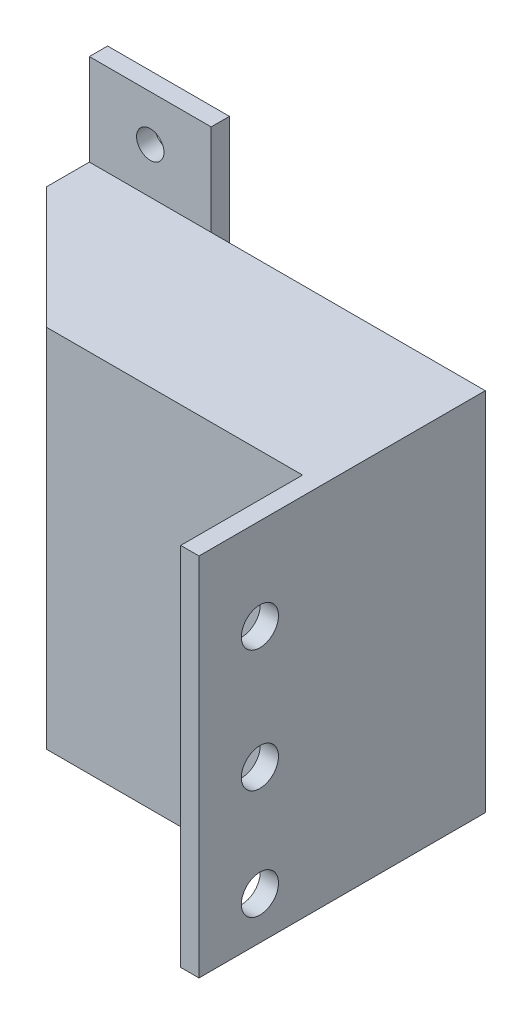
from build123d import *

# Parameters (mm, degrees)
SKETCH_1_W          = 5.1
SKETCH_1_H          = 50
EXTRUDE_1_DEPTH     = 2
SKETCH_2_W          = 20
SKETCH_2_H          = 60
EXTRUDE_2_DEPTH     = 30
SKETCH_3_W          = 3
SKETCH_3_H          = 60
EXTRUDE_3_DEPTH     = 45
FILLET_1_R          = 10
CHAMFER_1_SIZE      = 20
SKETCH_5_W          = 20
SKETCH_5_H          = 3
EXTRUDE_4_DEPTH     = 15
HOLE_WIZARD_M4_1_D  = 4.5
WRAP_START          = -11
WRAP_1_OUTLINE_W    = 0.358974359
WRAP_1_OUTLINE_H    = 1.346153846
WRAP_1_DEPTH        = 1
SKETCH_10_W         = 3
SKETCH_10_H         = 60
EXTRUDE_5_DEPTH     = 45
SKETCH_11_W         = 3
SKETCH_11_H         = 60
EXTRUDE_6_DEPTH     = 21
SKETCH_13_W         = 3
SKETCH_13_H         = 60
EXTRUDE_7_DEPTH     = 20
SKETCH_4_R          = 3.05
CUT_EXTRUDE_1_DEPTH = 20
SKETCH_14_W         = 21
SKETCH_14_H         = 60
EXTRUDE_8_DEPTH     = 42


# Read off the part's stored shape, not the designer's step: 곡면 포장1
with BuildPart() as part:
    # 스케치1 → 보스-돌출1 (new body)
    with BuildSketch(Plane.XY):
        Rectangle(SKETCH_1_W, SKETCH_1_H)
    extrude(amount=EXTRUDE_1_DEPTH)

    # 스케치2 → 보스-돌출2 (add)
    with BuildSketch(Plane.XY.offset(2)):
        Rectangle(SKETCH_2_W, SKETCH_2_H)
    extrude(amount=EXTRUDE_2_DEPTH)

    # 스케치3 → 보스-돌출3 (add)
    with BuildSketch(Plane.ZY.offset(-10)):
        with Locations((30.5, 0)):
            Rectangle(SKETCH_3_W, SKETCH_3_H)
    extrude(amount=-EXTRUDE_3_DEPTH)

    # 필렛1
    fillet_1_edges = [part.edges().sort_by_distance(p)[0] for p in [
        (10, 0, 29),
    ]]
    fillet(fillet_1_edges, radius=FILLET_1_R)

    # 모따기1
    chamfer_1_edges = [part.edges().sort_by_distance(p)[0] for p in [
        (-10, 0, 32),
    ]]
    chamfer(chamfer_1_edges, length=CHAMFER_1_SIZE)

    # 스케치5 → 보스-돌출4 (add)
    with BuildSketch(Plane.XZ.offset(30)):
        with Locations((0, 3.5)):
            Rectangle(SKETCH_5_W, SKETCH_5_H)
    extrude_4 = extrude(amount=EXTRUDE_4_DEPTH)

    # M4 여유 구멍1 (through all)
    with Locations(Plane.XY.offset(5)):
        with Locations((0, -37.5)):
            hole_wizard_m4_1 = Hole(HOLE_WIZARD_M4_1_D / 2)

    # 대칭 복사1: 보스-돌출4, M4 여유 구멍1 across plane
    add(extrude_4.mirror(Plane.ZX))
    add(hole_wizard_m4_1.mirror(Plane.ZX), mode=Mode.SUBTRACT)

    # 곡면 포장1 outline → 곡면 포장1 (cut)
    # profile 1 of 15: a face of its own
    with BuildSketch(Plane(origin=(-18.071067812, 0, 18.071067812), x_dir=(0.7071067811865461, 0, 0.7071067811865489), z_dir=(-0.7071067811865489, 0, 0.7071067811865461)).offset(WRAP_START)):
        with BuildLine():
            add(Edge.make_bspline(
                [(13.788664107, -7.655548878), (13.788508521, -7.702290007), (13.788209778, -7.792038151), (13.786544015, -7.920611421), (13.78176966, -8.037438518), (13.777661076, -8.142458358), (13.770169135, -8.235669013), (13.763008488, -8.317356304), (13.753634827, -8.387144001), (13.744929404, -8.429389852), (13.740987824, -8.448517628)],
                knots=[0, 0, 0, 0, 0.176257755, 0.338434414, 0.484822051, 0.617157578, 0.734698361, 0.837385184, 0.926372421, 1, 1, 1, 1], degree=3))
            Line((13.788664107, -7.655548878), (13.788664107, -6.955128205))
            Line((13.788664107, -6.955128205), (10.288664107, -6.955128205))
            Line((10.288664107, -6.955128205), (10.288664107, -7.269230769))
            Line((10.288664107, -7.269230769), (11.904048722, -7.269230769))
            Line((11.904048722, -7.269230769), (11.904048722, -7.524439103))
            Line((11.904048722, -7.524439103), (10.288664107, -8.810296474))
            Line((10.288664107, -8.810296474), (10.288664107, -9.198717949))
            Line((10.288664107, -9.198717949), (11.904048722, -7.912860577))
            add(Edge.make_bspline(
                [(12.85266651, -9.153846154), (12.806031352, -9.152377194), (12.71503408, -9.149510872), (12.582973948, -9.122785236), (12.459781892, -9.079010664), (12.345629353, -9.0186802), (12.242681333, -8.941887277), (12.152564561, -8.849599644), (12.076456841, -8.742288611), (12.024240237, -8.641920056), (11.990641836, -8.553217672), (11.966883204, -8.479978002), (11.948836227, -8.400025238), (11.932434047, -8.314506424), (11.919917866, -8.222761003), (11.911028998, -8.12497373), (11.905313389, -8.020900031), (11.904478314, -7.949560269), (11.904048722, -7.912860577)],
                knots=[0, 0, 0, 0, 0.078775142, 0.153710705, 0.226698871, 0.29917182, 0.371165996, 0.44297777, 0.516334013, 0.592857108, 0.63351018, 0.676623617, 0.722915422, 0.771971354, 0.823829257, 0.87938645, 0.937952132, 1, 1, 1, 1], degree=3))
            add(Edge.make_bspline(
                [(13.740987824, -8.448517628), (13.734661777, -8.474124703), (13.722144633, -8.524792585), (13.69567462, -8.597736108), (13.665093411, -8.667274573), (13.628895853, -8.733147024), (13.587713309, -8.795359571), (13.541305165, -8.853819065), (13.489435081, -8.908191276), (13.433427601, -8.958894573), (13.372794043, -9.004855479), (13.308417674, -9.044628631), (13.24070113, -9.07868618), (13.169408597, -9.105875346), (13.095142736, -9.127748197), (13.017255067, -9.143175849), (12.93609378, -9.152426646), (12.880735914, -9.153368555), (12.85266651, -9.153846154)],
                knots=[0, 0, 0, 0, 0.064210805, 0.127051819, 0.188726793, 0.24910868, 0.309897111, 0.370265578, 0.430668931, 0.492744591, 0.554114032, 0.615725916, 0.67682809, 0.73846364, 0.80133559, 0.865197187, 0.931647751, 1, 1, 1, 1], degree=3))
        make_face()
        with BuildLine():
            add(Edge.make_bspline(
                [(12.258115228, -7.91005609), (12.258101992, -7.939976129), (12.258076336, -7.997969685), (12.262070111, -8.081870352), (12.266613433, -8.159990458), (12.273562764, -8.232031229), (12.282518884, -8.298024742), (12.293721711, -8.35793836), (12.306774287, -8.411868744), (12.32697375, -8.474770095), (12.358994389, -8.544987611), (12.405502542, -8.621393654), (12.464378168, -8.686238827), (12.530631533, -8.742147935), (12.60497392, -8.785212188), (12.68410555, -8.816555408), (12.767343253, -8.836225025), (12.824515097, -8.838563465), (12.853367632, -8.83974359)],
                knots=[0, 0, 0, 0, 0.071662971, 0.138903248, 0.201170031, 0.259105703, 0.312232476, 0.360655445, 0.40505687, 0.445069493, 0.518740291, 0.589418982, 0.658414658, 0.727587276, 0.796337206, 0.863184781, 0.930954371, 1, 1, 1, 1], degree=3))
            Line((12.258115228, -7.91005609), (12.263023081, -7.269230769))
            Line((12.263023081, -7.269230769), (13.429689748, -7.269230769))
            Line((13.429689748, -7.269230769), (13.429689748, -7.925480769))
            add(Edge.make_bspline(
                [(12.853367632, -8.83974359), (12.881522011, -8.838559837), (12.937313718, -8.836214072), (13.018767154, -8.816517297), (13.096194016, -8.784709886), (13.168118494, -8.740108534), (13.233950486, -8.686214641), (13.289499403, -8.622207629), (13.336018384, -8.55131097), (13.365528527, -8.485000748), (13.383657077, -8.425772592), (13.396398241, -8.374340485), (13.40672109, -8.316005715), (13.41474691, -8.250908084), (13.42196923, -8.179165363), (13.426651992, -8.100581107), (13.429482253, -8.015246064), (13.429618973, -7.956098882), (13.429689748, -7.925480769)],
                knots=[0, 0, 0, 0, 0.068800096, 0.136336686, 0.203757018, 0.272787156, 0.342622324, 0.411089038, 0.479278287, 0.549403054, 0.587738712, 0.630724933, 0.678947097, 0.73255864, 0.791154526, 0.855313051, 0.925101397, 1, 1, 1, 1], degree=3))
        make_face(mode=Mode.SUBTRACT)
    # profile 2 of 15: a face of its own
    with BuildSketch(Plane(origin=(-18.071067812, 0, 18.071067812), x_dir=(0.7071067811865461, 0, 0.7071067811865489), z_dir=(-0.7071067811865489, 0, 0.7071067811865461)).offset(WRAP_START)):
        with BuildLine():
            add(Edge.make_bspline(
                [(13.788664107, -1.469551282), (13.788222743, -1.531020398), (13.78737003, -1.64977841), (13.781932485, -1.821389146), (13.772410584, -1.979946438), (13.758273272, -2.125360242), (13.741304536, -2.257864179), (13.719724539, -2.377246028), (13.694345003, -2.483699256), (13.672698534, -2.549168569), (13.662462183, -2.580128205)],
                knots=[0, 0, 0, 0, 0.164289634, 0.317406718, 0.458844777, 0.588746286, 0.707830576, 0.815769563, 0.912879682, 1, 1, 1, 1], degree=3))
            Line((13.788664107, -1.469551282), (13.788664107, -0.762820513))
            Line((13.788664107, -0.762820513), (10.288664107, -0.762820513))
            Line((10.288664107, -0.762820513), (10.288664107, -1.847455929))
            add(Edge.make_bspline(
                [(11.994493433, -3.634615385), (11.951232341, -3.633985993), (11.865981841, -3.632745712), (11.740338851, -3.621622463), (11.618432932, -3.605423973), (11.500799481, -3.580460174), (11.386646065, -3.549785684), (11.276514786, -3.511923904), (11.170324918, -3.46705403), (11.068941453, -3.414995964), (10.97253211, -3.35807278), (10.882755925, -3.295659839), (10.797905473, -3.231338607), (10.721807952, -3.160149504), (10.650111093, -3.086998251), (10.586688808, -3.008005778), (10.528778473, -2.925745612), (10.47680279, -2.838633295), (10.431708128, -2.744580876), (10.393076333, -2.642304664), (10.361266928, -2.531256899), (10.334685156, -2.41160779), (10.313611046, -2.28312289), (10.299483718, -2.145684341), (10.289931054, -1.999500932), (10.289094622, -1.899121683), (10.288664107, -1.847455929)],
                knots=[0, 0, 0, 0, 0.046075764, 0.090797106, 0.134280935, 0.177005489, 0.218799375, 0.260134691, 0.300966082, 0.341495783, 0.38146104, 0.4201336, 0.457931555, 0.494759361, 0.531031765, 0.566959908, 0.602530875, 0.638141029, 0.674887957, 0.713497957, 0.754468017, 0.797836943, 0.84400611, 0.893082984, 0.944969221, 1, 1, 1, 1], degree=3))
            add(Edge.make_bspline(
                [(13.662462183, -2.580128205), (13.647031461, -2.620622919), (13.616519932, -2.70069406), (13.558963882, -2.814701556), (13.493749844, -2.92202553), (13.420797433, -3.023249794), (13.338020201, -3.116031516), (13.249011593, -3.204111294), (13.150134467, -3.283535156), (13.044746001, -3.357490427), (12.931777075, -3.422202498), (12.813520445, -3.479271028), (12.69019738, -3.527997589), (12.560910273, -3.566017725), (12.42690027, -3.597428834), (12.287152918, -3.61850494), (12.142482909, -3.632504944), (12.044307183, -3.633905003), (11.994493433, -3.634615385)],
                knots=[0, 0, 0, 0, 0.061542118, 0.121688665, 0.181146473, 0.239864289, 0.298688121, 0.357630874, 0.417585519, 0.478660874, 0.54040425, 0.602339327, 0.665116206, 0.728571869, 0.79366009, 0.860540721, 0.929239235, 1, 1, 1, 1], degree=3))
        make_face()
        with BuildLine():
            add(Edge.make_bspline(
                [(10.647638466, -1.478665865), (10.647886562, -1.536394236), (10.648363742, -1.647427035), (10.652550945, -1.807085032), (10.659392883, -1.952964428), (10.668967961, -2.085085938), (10.681636576, -2.203374962), (10.695761478, -2.308078712), (10.713358929, -2.39885397), (10.729309889, -2.453783407), (10.736680933, -2.479166667)],
                knots=[0, 0, 0, 0, 0.171900665, 0.330627932, 0.475548836, 0.60674619, 0.725023803, 0.829742387, 0.92132282, 1, 1, 1, 1], degree=3))
            Line((10.647638466, -1.478665865), (10.647638466, -1.076923077))
            Line((10.647638466, -1.076923077), (13.429689748, -1.076923077))
            Line((13.429689748, -1.076923077), (13.429689748, -1.323016827))
            add(Edge.make_bspline(
                [(13.331532696, -2.39853766), (13.339649124, -2.369186514), (13.356906877, -2.306777924), (13.375732249, -2.20493846), (13.392336748, -2.09032331), (13.406394788, -1.962423609), (13.416482109, -1.82138515), (13.424053424, -1.667099462), (13.429160056, -1.499499857), (13.429508763, -1.383317324), (13.429689748, -1.323016827)],
                knots=[0, 0, 0, 0, 0.084318617, 0.179284514, 0.286582528, 0.405111483, 0.535592873, 0.67819021, 0.83297584, 1, 1, 1, 1], degree=3))
            add(Edge.make_bspline(
                [(11.995194555, -3.320512821), (12.03612779, -3.319998986), (12.116541493, -3.318989554), (12.234535663, -3.306322999), (12.348003724, -3.287773342), (12.45702737, -3.261091108), (12.561464756, -3.226619962), (12.661905911, -3.185372441), (12.757058251, -3.135291477), (12.847727682, -3.078594531), (12.932541072, -3.014941825), (13.010504786, -2.94461572), (13.081764053, -2.868357763), (13.146432328, -2.786519402), (13.203359577, -2.6979564), (13.254001168, -2.604167416), (13.297029276, -2.503831307), (13.31990646, -2.434017297), (13.331532696, -2.39853766)],
                knots=[0, 0, 0, 0, 0.070142057, 0.137794692, 0.20319983, 0.267139326, 0.329981104, 0.39158851, 0.453055056, 0.514082611, 0.574740811, 0.634598519, 0.69384165, 0.753473671, 0.813150092, 0.874096054, 0.936015332, 1, 1, 1, 1], degree=3))
            add(Edge.make_bspline(
                [(10.736680933, -2.479166667), (10.747931653, -2.511115704), (10.770164369, -2.574250677), (10.810734156, -2.665121994), (10.85873149, -2.749915039), (10.912398678, -2.830044457), (10.972566871, -2.904991377), (11.039418178, -2.974423322), (11.112213278, -3.038833767), (11.191224867, -3.097518126), (11.275942115, -3.149955691), (11.365286501, -3.195660839), (11.459042394, -3.234440983), (11.557547712, -3.265974844), (11.660709606, -3.290411773), (11.768256677, -3.30779836), (11.880222476, -3.318607055), (11.956374251, -3.319869339), (11.995194555, -3.320512821)],
                knots=[0, 0, 0, 0, 0.062403939, 0.123317361, 0.183093551, 0.241742082, 0.300863085, 0.359954277, 0.419145826, 0.479784587, 0.541094082, 0.602536544, 0.664519988, 0.727851781, 0.792929859, 0.859696073, 0.928476505, 1, 1, 1, 1], degree=3))
        make_face(mode=Mode.SUBTRACT)
    # profile 3 of 15: a face of its own
    with BuildSketch(Plane(origin=(-18.071067812, 0, 18.071067812), x_dir=(0.7071067811865461, 0, 0.7071067811865489), z_dir=(-0.7071067811865489, 0, 0.7071067811865461)).offset(WRAP_START)):
        with BuildLine():
            add(Edge.make_bspline(
                [(12.04006635, 2.198717949), (11.977108849, 2.200267808), (11.853012322, 2.203322761), (11.670869656, 2.229492583), (11.495776102, 2.270529749), (11.328040956, 2.329140113), (11.167424206, 2.404313011), (11.014705063, 2.497094259), (10.868791036, 2.605372274), (10.732735707, 2.729698441), (10.607733243, 2.865064185), (10.498564115, 3.010383474), (10.405271034, 3.162672396), (10.330253355, 3.323073057), (10.270521476, 3.489797255), (10.229757965, 3.664373013), (10.203473887, 3.846021356), (10.200454962, 3.969892113), (10.198920517, 4.032852564)],
                knots=[0, 0, 0, 0, 0.065222464, 0.128561033, 0.190308591, 0.251362421, 0.312368182, 0.373765555, 0.436259249, 0.500390872, 0.564506942, 0.626951797, 0.688474703, 0.749261276, 0.810166935, 0.871678873, 0.934777536, 1, 1, 1, 1], degree=3))
            add(Edge.make_bspline(
                [(13.878407696, 4.060897436), (13.876766202, 3.996089343), (13.873542172, 3.868800902), (13.848863281, 3.681725819), (13.806167112, 3.503131402), (13.74930697, 3.331558787), (13.673442092, 3.169074957), (13.581796276, 3.01440178), (13.473066102, 2.867976578), (13.349076013, 2.731141514), (13.21367798, 2.606384135), (13.068767329, 2.497384471), (12.916328385, 2.405226079), (12.7558307, 2.329690308), (12.587980681, 2.270378195), (12.411823966, 2.229462833), (12.228518017, 2.203323677), (12.10349105, 2.200268038), (12.04006635, 2.198717949)],
                knots=[0, 0, 0, 0, 0.066567809, 0.13074467, 0.193406333, 0.254980873, 0.316102986, 0.377249144, 0.439386092, 0.503131712, 0.566683974, 0.628243533, 0.689101006, 0.74935305, 0.810175941, 0.871614117, 0.934871362, 1, 1, 1, 1], degree=3))
            add(Edge.make_bspline(
                [(12.023239427, 5.878205128), (12.064872286, 5.877670983), (12.147612788, 5.876609431), (12.270476589, 5.863810525), (12.391377739, 5.845275858), (12.509909829, 5.818573828), (12.626092213, 5.784130474), (12.739687292, 5.741684884), (12.851630757, 5.693042221), (12.959792124, 5.635126411), (13.064341161, 5.57193853), (13.163970568, 5.503038494), (13.256900695, 5.427945901), (13.344624781, 5.34773343), (13.425645575, 5.261290761), (13.501729517, 5.169918853), (13.572089013, 5.073139608), (13.635246322, 4.970799966), (13.693257077, 4.865509115), (13.741691283, 4.756503166), (13.784500626, 4.646082034), (13.818521359, 4.533273087), (13.845595261, 4.418337269), (13.863991294, 4.3011309), (13.876818638, 4.181774699), (13.877875731, 4.101363215), (13.878407696, 4.060897436)],
                knots=[0, 0, 0, 0, 0.043213161, 0.085881169, 0.128132386, 0.170168405, 0.211938097, 0.253861187, 0.296020311, 0.338574299, 0.381150423, 0.422820599, 0.464244847, 0.505120974, 0.546150251, 0.587164454, 0.62852183, 0.670271074, 0.711969505, 0.753242069, 0.794029495, 0.834869589, 0.875486283, 0.916539236, 0.957999721, 1, 1, 1, 1], degree=3))
            add(Edge.make_bspline(
                [(10.198920517, 4.032852564), (10.200469696, 4.096277007), (10.20352354, 4.221303467), (10.229707926, 4.404838725), (10.270638297, 4.58112299), (10.329187728, 4.749613486), (10.404571132, 4.910365504), (10.49720614, 5.063363499), (10.606363774, 5.20879132), (10.730524416, 5.345169071), (10.865955216, 5.469799899), (11.010319314, 5.57941991), (11.162243726, 5.671520857), (11.32110219, 5.746936083), (11.486484086, 5.806586656), (11.659429726, 5.847295244), (11.838970001, 5.873630173), (11.961212794, 5.87666516), (12.023239427, 5.878205128)],
                knots=[0, 0, 0, 0, 0.065822946, 0.129754547, 0.192083828, 0.253475092, 0.314589033, 0.376095281, 0.438844932, 0.503090279, 0.567320043, 0.629681905, 0.690980548, 0.751436286, 0.811992743, 0.87314184, 0.935631505, 1, 1, 1, 1], degree=3))
        make_face()
        with BuildLine():
            add(Edge.make_bspline(
                [(12.024641671, 5.564102564), (11.97407945, 5.562827702), (11.87460792, 5.560319654), (11.728839776, 5.538362084), (11.588751489, 5.50454011), (11.45510958, 5.454682743), (11.326765297, 5.392332129), (11.204857193, 5.315305238), (11.089352318, 5.224046153), (10.981057049, 5.120382626), (10.882211245, 5.00705992), (10.795447836, 4.88672719), (10.722037587, 4.760673582), (10.662232514, 4.628570379), (10.614842776, 4.49112284), (10.582364145, 4.347445289), (10.56098869, 4.19849483), (10.558935934, 4.096964175), (10.557894876, 4.045472756)],
                knots=[0, 0, 0, 0, 0.064503999, 0.126899322, 0.18774654, 0.248149733, 0.308586065, 0.369583005, 0.431826965, 0.496179723, 0.560667855, 0.623504455, 0.685260411, 0.746536822, 0.808327352, 0.870486188, 0.934316883, 1, 1, 1, 1], degree=3))
            add(Edge.make_bspline(
                [(13.519433337, 4.045472756), (13.51902864, 4.078687466), (13.518223114, 4.14479935), (13.507604548, 4.243082765), (13.49248539, 4.340078919), (13.470863834, 4.435782535), (13.441675518, 4.529678594), (13.407283315, 4.622704775), (13.366826099, 4.7144144), (13.319651978, 4.803782221), (13.268119374, 4.890658858), (13.211560555, 4.973198892), (13.150249771, 5.050578929), (13.084996898, 5.123046846), (13.015138012, 5.190391473), (12.941788067, 5.253977931), (12.862835505, 5.311247039), (12.780425279, 5.363732744), (12.694663649, 5.41070055), (12.6064538, 5.452465914), (12.51507611, 5.48662992), (12.421521953, 5.514492297), (12.325939493, 5.537592108), (12.227603645, 5.552226032), (12.127008532, 5.562958391), (12.059026678, 5.563718237), (12.024641671, 5.564102564)],
                knots=[0, 0, 0, 0, 0.042024416, 0.083647076, 0.12498703, 0.166251764, 0.207706932, 0.249360068, 0.291742189, 0.334482094, 0.377200492, 0.419541296, 0.461030227, 0.502083397, 0.542878883, 0.583790046, 0.624853874, 0.66621605, 0.707391613, 0.74855017, 0.789649147, 0.830735346, 0.872066831, 0.913991169, 0.956497004, 1, 1, 1, 1], degree=3))
            add(Edge.make_bspline(
                [(12.040767472, 2.512820513), (12.074682976, 2.513221626), (12.141960626, 2.514017307), (12.241421445, 2.524559782), (12.338674656, 2.539660672), (12.433338459, 2.56142338), (12.525436984, 2.589473534), (12.614883732, 2.624060864), (12.702011927, 2.664846164), (12.786606224, 2.711654388), (12.867780962, 2.764270212), (12.945383374, 2.821764455), (13.017956118, 2.885129803), (13.087290802, 2.95255583), (13.151908728, 3.025726705), (13.211831111, 3.104311039), (13.268504912, 3.187354566), (13.319628455, 3.275282379), (13.366850247, 3.366024169), (13.407273407, 3.459146096), (13.441824259, 3.55375637), (13.470744361, 3.649370591), (13.492506573, 3.746662324), (13.507599124, 3.845064997), (13.518224251, 3.944746806), (13.519029029, 4.011790894), (13.519433337, 4.045472756)],
                knots=[0, 0, 0, 0, 0.042915312, 0.085130427, 0.126473997, 0.167453936, 0.207977448, 0.248250709, 0.288751535, 0.329671625, 0.370539274, 0.411130769, 0.451821335, 0.492408517, 0.533488722, 0.575266147, 0.617443924, 0.660675231, 0.703943979, 0.746871527, 0.789083532, 0.831391848, 0.87323731, 0.915165315, 0.95738043, 1, 1, 1, 1], degree=3))
            add(Edge.make_bspline(
                [(10.557894876, 4.045472756), (10.558370379, 4.010863254), (10.559313444, 3.942222215), (10.568812141, 3.840126708), (10.584043934, 3.739870442), (10.605974874, 3.641594362), (10.633421027, 3.545408809), (10.666032678, 3.450916768), (10.706699109, 3.359108076), (10.751702786, 3.268887475), (10.802638249, 3.1825127), (10.858406489, 3.100564027), (10.918620796, 3.023516545), (10.983307023, 2.951203375), (11.051907557, 2.883392125), (11.126186229, 2.821924156), (11.203973763, 2.763968973), (11.28657621, 2.711693427), (11.372518564, 2.664819001), (11.461062541, 2.624058781), (11.551903846, 2.589457641), (11.645196442, 2.56153049), (11.740757014, 2.539644663), (11.838715167, 2.524564842), (11.93887449, 2.514016376), (12.006618348, 2.513221303), (12.040767472, 2.512820513)],
                knots=[0, 0, 0, 0, 0.043634425, 0.08654017, 0.129180909, 0.171441065, 0.213421797, 0.255273015, 0.297377706, 0.33995015, 0.382358034, 0.423720748, 0.464871875, 0.505574132, 0.546005533, 0.586382115, 0.627054484, 0.668261509, 0.709541191, 0.750421251, 0.791090417, 0.832022499, 0.873132446, 0.914608403, 0.956954796, 1, 1, 1, 1], degree=3))
        make_face(mode=Mode.SUBTRACT)
    # profile 4 of 15: a face of its own
    with BuildSketch(Plane(origin=(-18.071067812, 0, 18.071067812), x_dir=(0.7071067811865461, 0, 0.7071067811865489), z_dir=(-0.7071067811865489, 0, 0.7071067811865461)).offset(WRAP_START)):
        with BuildLine():
            add(Edge.make_bspline(
                [(20.756612824, -9.456730769), (20.75617146, -9.518199885), (20.755318747, -9.636957897), (20.749881203, -9.808568633), (20.740359302, -9.967125925), (20.72622199, -10.11253973), (20.709253253, -10.245043666), (20.687673257, -10.364425515), (20.662293721, -10.470878743), (20.640647252, -10.536348056), (20.630410901, -10.567307692)],
                knots=[0, 0, 0, 0, 0.164289634, 0.317406718, 0.458844777, 0.588746286, 0.707830576, 0.815769563, 0.912879682, 1, 1, 1, 1], degree=3))
            Line((20.756612824, -9.456730769), (20.756612824, -8.75))
            Line((20.756612824, -8.75), (17.256612824, -8.75))
            Line((17.256612824, -8.75), (17.256612824, -9.834635417))
            add(Edge.make_bspline(
                [(18.962442151, -11.621794872), (18.919181059, -11.62116548), (18.833930559, -11.619925199), (18.708287569, -11.60880195), (18.58638165, -11.592603461), (18.468748198, -11.567639661), (18.354594783, -11.536965171), (18.244463504, -11.499103392), (18.138273636, -11.454233517), (18.036890171, -11.402175451), (17.940480828, -11.345252267), (17.850704643, -11.282839326), (17.765854191, -11.218518094), (17.68975667, -11.147328991), (17.618059811, -11.074177738), (17.554637526, -10.995185265), (17.49672719, -10.912925099), (17.444751508, -10.825812782), (17.399656846, -10.731760363), (17.361025051, -10.629484152), (17.329215646, -10.518436387), (17.302633874, -10.398787278), (17.281559764, -10.270302377), (17.267432436, -10.132863828), (17.257879772, -9.986680419), (17.25704334, -9.88630117), (17.256612824, -9.834635417)],
                knots=[0, 0, 0, 0, 0.046075764, 0.090797106, 0.134280935, 0.177005489, 0.218799375, 0.260134691, 0.300966082, 0.341495783, 0.38146104, 0.4201336, 0.457931555, 0.494759361, 0.531031765, 0.566959908, 0.602530875, 0.638141029, 0.674887957, 0.713497957, 0.754468017, 0.797836943, 0.84400611, 0.893082984, 0.944969221, 1, 1, 1, 1], degree=3))
            add(Edge.make_bspline(
                [(20.630410901, -10.567307692), (20.614980178, -10.607802406), (20.58446865, -10.687873547), (20.5269126, -10.801881043), (20.461698562, -10.909205017), (20.388746151, -11.010429281), (20.305968919, -11.103211003), (20.216960311, -11.191290781), (20.118083185, -11.270714643), (20.012694719, -11.344669914), (19.899725793, -11.409381985), (19.781469163, -11.466450515), (19.658146098, -11.515177076), (19.528858991, -11.553197213), (19.394848988, -11.584608321), (19.255101636, -11.605684427), (19.110431627, -11.619684431), (19.012255901, -11.62108449), (18.962442151, -11.621794872)],
                knots=[0, 0, 0, 0, 0.061542118, 0.121688665, 0.181146473, 0.239864289, 0.298688121, 0.357630874, 0.417585519, 0.478660874, 0.54040425, 0.602339327, 0.665116206, 0.728571869, 0.79366009, 0.860540721, 0.929239235, 1, 1, 1, 1], degree=3))
        make_face()
        with BuildLine():
            add(Edge.make_bspline(
                [(17.615587183, -9.465845353), (17.61583528, -9.523573723), (17.61631246, -9.634606522), (17.620499663, -9.794264519), (17.627341601, -9.940143915), (17.636916678, -10.072265425), (17.649585294, -10.190554449), (17.663710196, -10.295258199), (17.681307647, -10.386033457), (17.697258607, -10.440962894), (17.704629651, -10.466346154)],
                knots=[0, 0, 0, 0, 0.171900665, 0.330627932, 0.475548836, 0.60674619, 0.725023803, 0.829742387, 0.92132282, 1, 1, 1, 1], degree=3))
            Line((17.615587183, -9.465845353), (17.615587183, -9.064102564))
            Line((17.615587183, -9.064102564), (20.397638466, -9.064102564))
            Line((20.397638466, -9.064102564), (20.397638466, -9.310196314))
            add(Edge.make_bspline(
                [(20.299481414, -10.385717147), (20.307597842, -10.356366001), (20.324855595, -10.293957411), (20.343680967, -10.192117947), (20.360285466, -10.077502797), (20.374343506, -9.949603096), (20.384430827, -9.808564637), (20.392002142, -9.654278949), (20.397108774, -9.486679345), (20.397457481, -9.370496811), (20.397638466, -9.310196314)],
                knots=[0, 0, 0, 0, 0.084318617, 0.179284514, 0.286582528, 0.405111483, 0.535592873, 0.67819021, 0.83297584, 1, 1, 1, 1], degree=3))
            add(Edge.make_bspline(
                [(18.963143273, -11.307692308), (19.004076508, -11.307178473), (19.084490211, -11.306169041), (19.202484381, -11.293502486), (19.315952442, -11.274952829), (19.424976088, -11.248270595), (19.529413474, -11.213799449), (19.629854629, -11.172551929), (19.725006969, -11.122470964), (19.8156764, -11.065774018), (19.90048979, -11.002121312), (19.978453504, -10.931795208), (20.049712771, -10.85553725), (20.114381046, -10.77369889), (20.171308295, -10.685135887), (20.221949886, -10.591346903), (20.264977994, -10.491010794), (20.287855178, -10.421196784), (20.299481414, -10.385717147)],
                knots=[0, 0, 0, 0, 0.070142057, 0.137794692, 0.20319983, 0.267139326, 0.329981104, 0.39158851, 0.453055056, 0.514082611, 0.574740811, 0.634598519, 0.69384165, 0.753473671, 0.813150092, 0.874096054, 0.936015332, 1, 1, 1, 1], degree=3))
            add(Edge.make_bspline(
                [(17.704629651, -10.466346154), (17.715880371, -10.498295191), (17.738113087, -10.561430165), (17.778682874, -10.652301481), (17.826680208, -10.737094527), (17.880347396, -10.817223944), (17.940515589, -10.892170865), (18.007366896, -10.961602809), (18.080161996, -11.026013254), (18.159173585, -11.084697613), (18.243890833, -11.137135178), (18.333235219, -11.182840327), (18.426991112, -11.221620471), (18.52549643, -11.253154331), (18.628658324, -11.27759126), (18.736205395, -11.294977847), (18.848171194, -11.305786542), (18.924322969, -11.307048826), (18.963143273, -11.307692308)],
                knots=[0, 0, 0, 0, 0.062403939, 0.123317361, 0.183093551, 0.241742082, 0.300863085, 0.359954277, 0.419145826, 0.479784587, 0.541094082, 0.602536544, 0.664519988, 0.727851781, 0.792929859, 0.859696073, 0.928476505, 1, 1, 1, 1], degree=3))
        make_face(mode=Mode.SUBTRACT)
    # profile 5 of 15: a face of its own
    with BuildSketch(Plane(origin=(-18.071067812, 0, 18.071067812), x_dir=(0.7071067811865461, 0, 0.7071067811865489), z_dir=(-0.7071067811865489, 0, 0.7071067811865461)).offset(WRAP_START)):
        with BuildLine():
            add(Edge.make_bspline(
                [(19.477065549, 3.936798878), (19.487295821, 3.899743004), (19.507115354, 3.827953108), (19.529121125, 3.721993247), (19.542386569, 3.621401044), (19.544197879, 3.556125673), (19.545074363, 3.524539263)],
                knots=[0, 0, 0, 0, 0.275068369, 0.53290146, 0.77397346, 1, 1, 1, 1], degree=3))
            Line((19.477065549, 3.936798878), (20.397638466, 3.748197115))
            Line((20.397638466, 3.748197115), (20.397638466, 2.557692308))
            Line((20.397638466, 2.557692308), (20.756612824, 2.557692308))
            Line((20.756612824, 2.557692308), (20.756612824, 3.993589744))
            Line((20.756612824, 3.993589744), (19.006612824, 4.352564103))
            add(Edge.make_bspline(
                [(19.186100004, 3.581330128), (19.185539128, 3.608694651), (19.184390929, 3.664714078), (19.175354835, 3.75084385), (19.161453675, 3.840959451), (19.141417667, 3.935410736), (19.116331205, 4.0339385), (19.08500136, 4.136706598), (19.04891333, 4.243717511), (19.020922224, 4.315743518), (19.006612824, 4.352564103)],
                knots=[0, 0, 0, 0, 0.103079834, 0.211020423, 0.325963212, 0.446499825, 0.574634423, 0.708899897, 0.85118603, 1, 1, 1, 1], degree=3))
            add(Edge.make_bspline(
                [(18.413463786, 2.737179487), (18.441556455, 2.737731907), (18.496575369, 2.73881381), (18.576714537, 2.750836408), (18.653091831, 2.767678202), (18.725024233, 2.793536629), (18.79356509, 2.825486909), (18.857247376, 2.866021994), (18.917707201, 2.912357771), (18.972488408, 2.966629783), (19.023390169, 3.025811104), (19.066718916, 3.091275535), (19.103186972, 3.16152988), (19.134653827, 3.235761021), (19.157254892, 3.315725489), (19.174222687, 3.399842243), (19.184038075, 3.489018917), (19.18539996, 3.54998961), (19.186100004, 3.581330128)],
                knots=[0, 0, 0, 0, 0.065357917, 0.128002138, 0.188327309, 0.247189067, 0.30560896, 0.364041525, 0.422603178, 0.482635561, 0.54325455, 0.604078366, 0.664931386, 0.727386234, 0.791446771, 0.858041248, 0.927029518, 1, 1, 1, 1], degree=3))
            add(Edge.make_bspline(
                [(17.525843594, 3.625500801), (17.526664372, 3.595542357), (17.52828049, 3.536553935), (17.540719502, 3.449742548), (17.559877073, 3.365929674), (17.588546928, 3.285942317), (17.623391647, 3.208380777), (17.668106723, 3.135207007), (17.719566741, 3.06430413), (17.778523371, 2.997875996), (17.843493066, 2.937036547), (17.912970459, 2.883280426), (17.987087306, 2.838503513), (18.064560459, 2.800769404), (18.146239016, 2.772116105), (18.231740191, 2.751675124), (18.321275171, 2.739672065), (18.382344481, 2.738020885), (18.413463786, 2.737179487)],
                knots=[0, 0, 0, 0, 0.064207295, 0.12642469, 0.187680284, 0.248216424, 0.30830506, 0.369660991, 0.431698552, 0.495946892, 0.559758024, 0.622295408, 0.683910635, 0.745092408, 0.806740225, 0.869086618, 0.933290003, 1, 1, 1, 1], degree=3))
            add(Edge.make_bspline(
                [(18.154048722, 4.397435897), (18.120669085, 4.389712204), (18.056511569, 4.374866837), (17.966422606, 4.342196359), (17.885838916, 4.302496932), (17.814684425, 4.254216083), (17.752309933, 4.197787487), (17.696245449, 4.133858736), (17.64633621, 4.061519082), (17.604466634, 3.981164638), (17.568810723, 3.896340918), (17.545055609, 3.80757654), (17.528355609, 3.717271454), (17.526683729, 3.656193183), (17.525843594, 3.625500801)],
                knots=[0, 0, 0, 0, 0.094699119, 0.182016965, 0.264410083, 0.342584414, 0.419031742, 0.496445972, 0.577316123, 0.661468169, 0.746700809, 0.831236836, 0.915194989, 1, 1, 1, 1], degree=3))
            Line((18.154048722, 4.397435897), (18.154048722, 4.711538462))
            add(Edge.make_bspline(
                [(17.166869235, 3.643729968), (17.167560133, 3.678604106), (17.168919394, 3.747214853), (17.183137017, 3.847736028), (17.203504084, 3.944448412), (17.234128875, 4.03658661), (17.272558529, 4.124927994), (17.320819458, 4.208296572), (17.376273463, 4.288330992), (17.440833891, 4.362856012), (17.512060848, 4.431883876), (17.588527298, 4.494624208), (17.670537283, 4.549647104), (17.757392623, 4.597177108), (17.849242768, 4.637660954), (17.946362565, 4.669479852), (18.048263447, 4.695157136), (18.118416836, 4.706020704), (18.154048722, 4.711538462)],
                knots=[0, 0, 0, 0, 0.06542661, 0.128719126, 0.190252037, 0.250745351, 0.310663134, 0.370797387, 0.431290701, 0.493204103, 0.555569795, 0.617310395, 0.678641191, 0.740689695, 0.802968901, 0.866791451, 0.932341519, 1, 1, 1, 1], degree=3))
            add(Edge.make_bspline(
                [(18.400142472, 2.423076923), (18.371620214, 2.423741909), (18.314961152, 2.425062893), (18.2308175, 2.431782794), (18.148452626, 2.444713625), (18.067867765, 2.462099379), (17.989170651, 2.484575374), (17.912389909, 2.512079677), (17.837289119, 2.54450047), (17.763863362, 2.581104314), (17.694376237, 2.623448177), (17.627755105, 2.668052495), (17.566451765, 2.717461803), (17.508228236, 2.769283946), (17.455371048, 2.825591079), (17.405618212, 2.884635518), (17.36113089, 2.94780289), (17.320212597, 3.013962263), (17.283575946, 3.083071918), (17.253014436, 3.155832613), (17.226227008, 3.23064706), (17.204443329, 3.308182073), (17.187542343, 3.388287443), (17.176033001, 3.471239018), (17.167658953, 3.556620563), (17.16713427, 3.614495456), (17.166869235, 3.643729968)],
                knots=[0, 0, 0, 0, 0.044009715, 0.087424677, 0.13010434, 0.172535051, 0.214531574, 0.2562704, 0.298262281, 0.340668476, 0.382714494, 0.423714911, 0.46425621, 0.504079335, 0.543863271, 0.583286153, 0.623102749, 0.662925874, 0.703243716, 0.743625988, 0.784564534, 0.825768938, 0.867771652, 0.910754808, 0.954919318, 1, 1, 1, 1], degree=3))
            add(Edge.make_bspline(
                [(19.545074363, 3.524539263), (19.544228206, 3.485455658), (19.54256445, 3.408607526), (19.526595747, 3.296166662), (19.501444406, 3.188840729), (19.466365355, 3.086813097), (19.421219084, 2.98986401), (19.365554677, 2.898534876), (19.299757158, 2.8123081), (19.224461363, 2.732323565), (19.1414904, 2.659874142), (19.052571446, 2.595922811), (18.957623621, 2.542735942), (18.857066778, 2.498978306), (18.751069639, 2.464260848), (18.638847617, 2.441090262), (18.521396576, 2.425678694), (18.441092412, 2.423955593), (18.400142472, 2.423076923)],
                knots=[0, 0, 0, 0, 0.065798302, 0.129375902, 0.190866957, 0.251245391, 0.310770834, 0.370654461, 0.43104316, 0.493147329, 0.555361192, 0.61631564, 0.677301857, 0.738296968, 0.800790423, 0.864796781, 0.931055085, 1, 1, 1, 1], degree=3))
        make_face()
    # profile 6 of 15: a face of its own
    with BuildSketch(Plane(origin=(-18.071067812, 0, 18.071067812), x_dir=(0.7071067811865461, 0, 0.7071067811865489), z_dir=(-0.7071067811865489, 0, 0.7071067811865461)).offset(WRAP_START)):
        with BuildLine():
            add(Edge.make_bspline(
                [(20.756612824, 12.733774038), (20.756437074, 12.70034556), (20.756096426, 12.63555285), (20.750813295, 12.541333408), (20.743609625, 12.453084597), (20.732179532, 12.370780825), (20.718387755, 12.294460123), (20.701685939, 12.223892485), (20.681659326, 12.159302313), (20.649813044, 12.082189577), (20.602489876, 11.994268916), (20.532561311, 11.899070523), (20.447028848, 11.817666284), (20.350546192, 11.747479967), (20.24441042, 11.691678847), (20.131151232, 11.65130955), (20.01222949, 11.625751674), (19.930586312, 11.62312324), (19.889325164, 11.621794872)],
                knots=[0, 0, 0, 0, 0.062594097, 0.121322939, 0.176680142, 0.228365096, 0.276868446, 0.321879128, 0.364098625, 0.403355696, 0.477967948, 0.550535461, 0.623584457, 0.698174882, 0.77335367, 0.847281125, 0.92281834, 1, 1, 1, 1], degree=3))
            Line((20.756612824, 12.733774038), (20.756612824, 13.416666667))
            Line((20.756612824, 13.416666667), (17.256612824, 13.416666667))
            Line((17.256612824, 13.416666667), (17.256612824, 12.470152244))
            add(Edge.make_bspline(
                [(18.250102408, 11.352564103), (18.215935729, 11.353541255), (18.148711833, 11.35546383), (18.049953931, 11.369639423), (17.955589154, 11.393664623), (17.864946555, 11.42667656), (17.778539202, 11.470006093), (17.695284916, 11.521600276), (17.617401534, 11.584396935), (17.543036905, 11.654392701), (17.476213533, 11.733670436), (17.416722176, 11.819192496), (17.367572187, 11.91218897), (17.326801071, 12.011217729), (17.295203663, 12.116936823), (17.273267278, 12.22895427), (17.258452098, 12.347294412), (17.257236319, 12.428504748), (17.256612824, 12.470152244)],
                knots=[0, 0, 0, 0, 0.061150285, 0.1203149, 0.178151147, 0.235196698, 0.292635149, 0.350905536, 0.410166215, 0.471419452, 0.533450665, 0.595418361, 0.6575567, 0.72134071, 0.786857339, 0.854709892, 0.92549016, 1, 1, 1, 1], degree=3))
            add(Edge.make_bspline(
                [(19.144733818, 12.026342147), (19.129480599, 11.986575061), (19.100297413, 11.910490773), (19.048421143, 11.805713459), (18.992633874, 11.715078756), (18.931388931, 11.638486903), (18.864547857, 11.57397012), (18.793449108, 11.51603271), (18.714592394, 11.46749415), (18.630223105, 11.425795436), (18.540933385, 11.392978985), (18.447131592, 11.369759193), (18.349866599, 11.35549176), (18.283570623, 11.353546253), (18.250102408, 11.352564103)],
                knots=[0, 0, 0, 0, 0.106025209, 0.202852489, 0.290704804, 0.370602875, 0.446332657, 0.52168576, 0.598556536, 0.676384223, 0.755746288, 0.834937434, 0.916671422, 1, 1, 1, 1], degree=3))
            add(Edge.make_bspline(
                [(19.889325164, 11.621794872), (19.850666059, 11.622866962), (19.774697273, 11.624973719), (19.663763504, 11.645805371), (19.557728953, 11.67682073), (19.457900806, 11.721845867), (19.365562071, 11.779762126), (19.281261514, 11.84945766), (19.207042088, 11.932439303), (19.165722365, 11.994710965), (19.144733818, 12.026342147)],
                knots=[0, 0, 0, 0, 0.13053328, 0.256510205, 0.3802179, 0.503255431, 0.625338329, 0.747617853, 0.871801305, 1, 1, 1, 1], degree=3))
        make_face()
        with BuildLine():
            add(Edge.make_bspline(
                [(17.615587183, 12.655248397), (17.615969591, 12.623229313), (17.61670663, 12.561516748), (17.619139024, 12.472417631), (17.624555603, 12.390059263), (17.633386073, 12.314394252), (17.6425617, 12.244756541), (17.655261211, 12.181837981), (17.669699021, 12.125542113), (17.692042214, 12.060273922), (17.726693512, 11.986730556), (17.779280566, 11.907531756), (17.841104986, 11.836414484), (17.913560928, 11.776715097), (17.991747909, 11.727417683), (18.075256984, 11.692842531), (18.16154054, 11.670611203), (18.220522357, 11.667984159), (18.250102408, 11.666666667)],
                knots=[0, 0, 0, 0, 0.072488851, 0.139712704, 0.201757177, 0.259247209, 0.312145205, 0.360703514, 0.40446219, 0.44361258, 0.516741518, 0.587761698, 0.658235896, 0.729226511, 0.799551612, 0.866660864, 0.93312891, 1, 1, 1, 1], degree=3))
            Line((17.615587183, 12.655248397), (17.615587183, 13.102564103))
            Line((17.615587183, 13.102564103), (18.916869235, 13.102564103))
            Line((18.916869235, 13.102564103), (18.916869235, 12.894330929))
            add(Edge.make_bspline(
                [(18.875503049, 12.239483173), (18.878958365, 12.256512253), (18.886450203, 12.293434811), (18.894353441, 12.353642697), (18.901442902, 12.42260905), (18.906549295, 12.500039096), (18.912030918, 12.586240784), (18.914086861, 12.68118642), (18.916596248, 12.784943128), (18.916775911, 12.856935589), (18.916869235, 12.894330929)],
                knots=[0, 0, 0, 0, 0.079306569, 0.171952999, 0.277056798, 0.395795151, 0.526176825, 0.671344422, 0.829285078, 1, 1, 1, 1], degree=3))
            add(Edge.make_bspline(
                [(18.250102408, 11.666666667), (18.268598141, 11.666935958), (18.305291269, 11.667470197), (18.359172207, 11.675830138), (18.411597797, 11.687492801), (18.461775289, 11.70438134), (18.510521177, 11.725676419), (18.556986384, 11.752400935), (18.602281911, 11.783262688), (18.659479897, 11.831540668), (18.725404123, 11.901695558), (18.789939213, 12.00140805), (18.841987701, 12.114778734), (18.864087081, 12.197006456), (18.875503049, 12.239483173)],
                knots=[0, 0, 0, 0, 0.060291948, 0.119611382, 0.177516768, 0.235397039, 0.292079166, 0.350822215, 0.410053339, 0.470691574, 0.594798123, 0.722557885, 0.856680573, 1, 1, 1, 1], degree=3))
        make_face(mode=Mode.SUBTRACT)
        with BuildLine():
            add(Edge.make_bspline(
                [(19.275843594, 12.891526442), (19.276240189, 12.860677369), (19.277006491, 12.801070673), (19.27927077, 12.714521382), (19.285333207, 12.634384063), (19.291745235, 12.560382578), (19.301618446, 12.493012917), (19.313700482, 12.432049544), (19.326366633, 12.376944817), (19.347967837, 12.313425849), (19.379568467, 12.241396181), (19.429763247, 12.165097867), (19.487924833, 12.096742603), (19.556273398, 12.039666819), (19.630894889, 11.992569321), (19.711795959, 11.961138494), (19.795818256, 11.938845022), (19.853651726, 11.936890029), (19.883015068, 11.935897436)],
                knots=[0, 0, 0, 0, 0.072280123, 0.139659927, 0.202776187, 0.260525273, 0.313642582, 0.362177144, 0.40613197, 0.445953959, 0.519224732, 0.589690423, 0.659172928, 0.728715809, 0.79754812, 0.864854476, 0.931383604, 1, 1, 1, 1], degree=3))
            Line((19.275843594, 12.891526442), (19.275843594, 13.102564103))
            Line((19.275843594, 13.102564103), (20.397638466, 13.102564103))
            Line((20.397638466, 13.102564103), (20.397638466, 12.676282051))
            add(Edge.make_bspline(
                [(19.883015068, 11.935897436), (19.902449989, 11.936393874), (19.940573708, 11.93736769), (19.995935241, 11.946230581), (20.048669053, 11.959090721), (20.097562305, 11.979182183), (20.144004681, 12.003476914), (20.185933366, 12.035079949), (20.225645462, 12.070770492), (20.26168284, 12.11268556), (20.293972471, 12.160622198), (20.322384515, 12.215037156), (20.344796747, 12.276580174), (20.364901713, 12.343855835), (20.378852368, 12.417940826), (20.390516973, 12.498111236), (20.396446415, 12.585047174), (20.397232253, 12.645192101), (20.397638466, 12.676282051)],
                knots=[0, 0, 0, 0, 0.05698453, 0.111781378, 0.164173981, 0.215875364, 0.266501336, 0.31752518, 0.369467046, 0.4229479, 0.47924747, 0.538751143, 0.602560434, 0.671136904, 0.744568184, 0.823511586, 0.908770095, 1, 1, 1, 1], degree=3))
        make_face(mode=Mode.SUBTRACT)
    # profile 7 of 15: a face of its own
    with BuildSketch(Plane(origin=(-18.071067812, 0, 18.071067812), x_dir=(0.7071067811865461, 0, 0.7071067811865489), z_dir=(-0.7071067811865489, 0, 0.7071067811865461)).offset(WRAP_START)):
        Polygon((10.288664107, -4.352564103), (10.288664107, -6.326923077), (10.647638466, -6.326923077), (10.647638466, -4.666666667), (11.993792312, -4.666666667), (11.993792312, -6.326923077), (12.352766671, -6.326923077), (12.352766671, -4.666666667), (13.429689748, -4.666666667), (13.429689748, -6.326923077), (13.788664107, -6.326923077), (13.788664107, -4.352564103), align=None)
    # profile 8 of 15: a face of its own
    with BuildSketch(Plane(origin=(-18.071067812, 0, 18.071067812), x_dir=(0.7071067811865461, 0, 0.7071067811865489), z_dir=(-0.7071067811865489, 0, 0.7071067811865461)).offset(WRAP_START)):
        Polygon((10.288664107, 1.480769231), (10.288664107, -0.179487179), (10.647638466, -0.179487179), (10.647638466, 1.166666667), (13.788664107, 1.166666667), (13.788664107, 1.480769231), align=None)
    # profile 9 of 15: a face of its own
    with BuildSketch(Plane(origin=(-18.071067812, 0, 18.071067812), x_dir=(0.7071067811865461, 0, 0.7071067811865489), z_dir=(-0.7071067811865489, 0, 0.7071067811865461)).offset(WRAP_START)):
        Polygon((10.288664107, 6.91025641), (10.288664107, 6.596153846), (13.788664107, 6.596153846), (13.788664107, 6.91025641), (12.352766671, 6.91025641), (12.352766671, 8.705128205), (13.788664107, 8.705128205), (13.788664107, 9.019230769), (10.288664107, 9.019230769), (10.288664107, 8.705128205), (11.993792312, 8.705128205), (11.993792312, 6.91025641), align=None)
    # profile 10 of 15: a face of its own
    with BuildSketch(Plane(origin=(-18.071067812, 0, 18.071067812), x_dir=(0.7071067811865461, 0, 0.7071067811865489), z_dir=(-0.7071067811865489, 0, 0.7071067811865461)).offset(WRAP_START)):
        Polygon((20.756612824, -13.775641026), (20.756612824, -11.935897436), (20.397638466, -11.935897436), (20.397638466, -12.698717949), (17.256612824, -12.698717949), (17.256612824, -13.012820513), (20.397638466, -13.012820513), (20.397638466, -13.775641026), align=None)
    # profile 11 of 15: a face of its own
    with BuildSketch(Plane(origin=(-18.071067812, 0, 18.071067812), x_dir=(0.7071067811865461, 0, 0.7071067811865489), z_dir=(-0.7071067811865489, 0, 0.7071067811865461)).offset(WRAP_START)):
        Polygon((20.756612824, -4.635116186), (20.756612824, -4.590244391), (17.256612824, -4.128205128), (17.256612824, -4.444411058), (19.780651286, -4.778846154), (17.256612824, -6.047175481), (17.256612824, -6.117988782), (19.775042312, -7.381410256), (17.256612824, -7.716546474), (17.256612824, -8.032051282), (20.756612824, -7.567207532), (20.756612824, -7.521634615), (17.884817953, -6.080128205), align=None)
    # profile 12 of 15: a face of its own
    with BuildSketch(Plane(origin=(-18.071067812, 0, 18.071067812), x_dir=(0.7071067811865461, 0, 0.7071067811865489), z_dir=(-0.7071067811865489, 0, 0.7071067811865461)).offset(WRAP_START)):
        Polygon((20.756612824, 1.422576122), (20.756612824, 1.467447917), (17.256612824, 1.929487179), (17.256612824, 1.61328125), (19.780651286, 1.278846154), (17.256612824, 0.010516827), (17.256612824, -0.060296474), (19.775042312, -1.323717949), (17.256612824, -1.658854167), (17.256612824, -1.974358974), (20.756612824, -1.509515224), (20.756612824, -1.463942308), (17.884817953, -0.022435897), align=None)
    # profile 13 of 15: a face of its own
    with BuildSketch(Plane(origin=(-18.071067812, 0, 18.071067812), x_dir=(0.7071067811865461, 0, 0.7071067811865489), z_dir=(-0.7071067811865489, 0, 0.7071067811865461)).offset(WRAP_START)):
        Polygon((20.756612824, 7.966145833), (20.756612824, 8.032051282), (17.256612824, 8.032051282), (17.256612824, 7.717948718), (20.00501026, 7.717948718), (17.256612824, 5.411258013), (17.256612824, 5.33974359), (20.756612824, 5.33974359), (20.756612824, 5.653846154), (18.001905292, 5.653846154), align=None)
    # profile 14 of 15: a face of its own
    with BuildSketch(Plane(origin=(-18.071067812, 0, 18.071067812), x_dir=(0.7071067811865461, 0, 0.7071067811865489), z_dir=(-0.7071067811865489, 0, 0.7071067811865461)).offset(WRAP_START)):
        Polygon((20.756612824, 8.66025641), (20.756612824, 10.634615385), (17.256612824, 10.634615385), (17.256612824, 8.66025641), (17.615587183, 8.66025641), (17.615587183, 10.320512821), (18.96174103, 10.320512821), (18.96174103, 8.66025641), (19.320715389, 8.66025641), (19.320715389, 10.320512821), (20.397638466, 10.320512821), (20.397638466, 8.66025641), align=None)
    # profile 15 of 15: a face of its own
    with BuildSketch(Plane(origin=(-18.071067812, 0, 18.071067812), x_dir=(0.7071067811865461, 0, 0.7071067811865489), z_dir=(-0.7071067811865489, 0, 0.7071067811865461)).offset(WRAP_START)):
        with Locations((18.602766671, -3.051282051)):
            Rectangle(WRAP_1_OUTLINE_W, WRAP_1_OUTLINE_H)
    extrude(amount=WRAP_1_DEPTH, mode=Mode.SUBTRACT)

    # 스케치10 → 보스-돌출5 (add)
    with BuildSketch(Plane(origin=(10, 0, 0), x_dir=(0, 0, -1), z_dir=(1, 0, 0))):
        with Locations((-6.5, 0)):
            Rectangle(SKETCH_10_W, SKETCH_10_H)
    extrude(amount=EXTRUDE_5_DEPTH)

    # 스케치11 → 보스-돌출6 (add)
    with BuildSketch(Plane.XY.offset(8)):
        with Locations((53.5, 0)):
            Rectangle(SKETCH_11_W, SKETCH_11_H)
    extrude(amount=EXTRUDE_6_DEPTH)

    # 스케치13 → 보스-돌출7 (add)
    with BuildSketch(Plane.XY.offset(32)):
        with Locations((53.5, 0)):
            Rectangle(SKETCH_13_W, SKETCH_13_H)
    extrude(amount=EXTRUDE_7_DEPTH)

    # 스케치4 → 컷-돌출1 (cut)
    with BuildSketch(Plane(origin=(52, 0, -20), x_dir=(0, 0, 1), z_dir=(-1, 0, 0))):
        with Locations(Location((62, -23, 0), (0, 0, 270))):
            Circle(SKETCH_4_R)
        with Locations(Location((62, -5, 0), (0, 0, 270))):
            Circle(SKETCH_4_R)
        with Locations(Location((62, 15, 0), (0, 0, 270))):
            Circle(SKETCH_4_R)
    extrude(amount=-CUT_EXTRUDE_1_DEPTH, mode=Mode.SUBTRACT)

    # 스케치14 → 보스-돌출8 (add)
    with BuildSketch(Plane.ZY.offset(-52)):
        with Locations((18.5, 0)):
            Rectangle(SKETCH_14_W, SKETCH_14_H)
    extrude(amount=EXTRUDE_8_DEPTH)


solid = part.part
